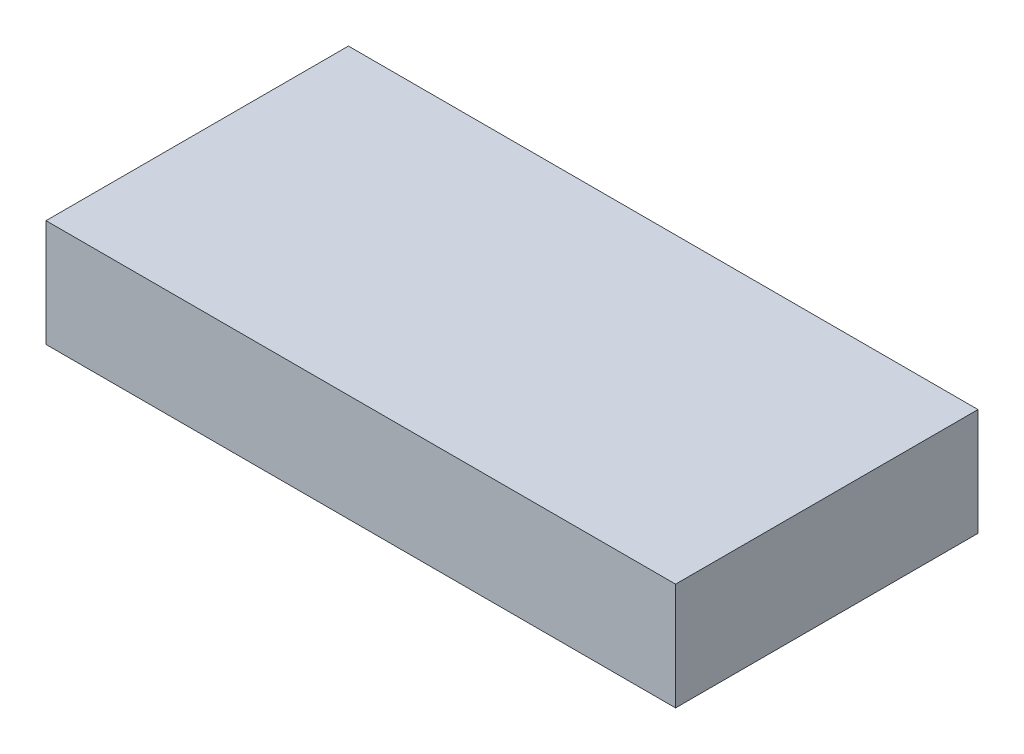
from build123d import *

# Parameters (mm, degrees)
SKETCH1_W           = 1145
SKETCH1_H           = 550
BOSS_EXTRUDE1_DEPTH = 195


with BuildPart() as part:
    # Sketch1 → Boss-Extrude1 (new body)
    with BuildSketch(Plane(origin=(0, 0, 0), x_dir=(1, 0, 0), z_dir=(0, 1, 0))):
        Rectangle(SKETCH1_W, SKETCH1_H)
    extrude(amount=BOSS_EXTRUDE1_DEPTH)


solid = part.part
